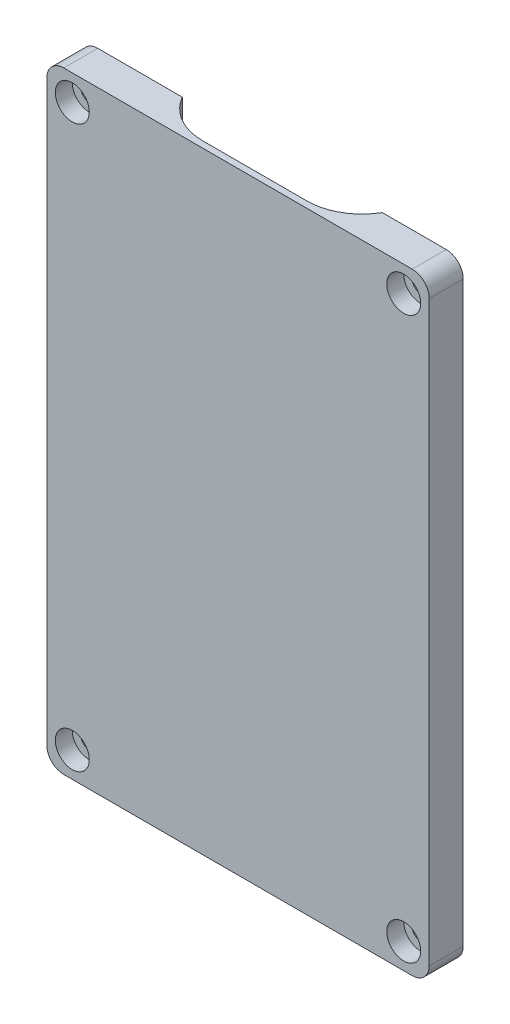
from build123d import *

# Parameters (mm, degrees)
SKETCH_1_W          = 22.5
SKETCH_1_H          = 36
EXTRUDE_1_DEPTH     = 2
SKETCH_9_R          = 1
CUT_EXTRUDE_3_DEPTH = 1
CUT_EXTRUDE_4_REACH = 145.222
SKETCH_10_R         = 0.5
FILLET_1_R          = 1
SKETCH_11_W         = 5.762947655
SKETCH_11_H         = 2.6557086
EXTRUDE_2_DEPTH     = 2.7
SKETCH_12_W         = 8
SKETCH_12_H         = 1.496173859
EXTRUDE_3_DEPTH     = 2.2
SKETCH_14_W         = 2
SKETCH_14_H         = 13.482091112
CUT_EXTRUDE_6_DEPTH = 0.0001
FILLET_3_R          = 2
CUT_EXTRUDE_7_DEPTH = 2.62
FILLET_7_R          = 1


with BuildPart() as part:
    # 草图1 → 凸台-拉伸1 (new body)
    with BuildSketch(Plane.XY):
        with Locations((-109.040086771, 59.72858385)):
            Rectangle(SKETCH_1_W, SKETCH_1_H)
    extrude(amount=EXTRUDE_1_DEPTH)

    # 草图9 → 切除-拉伸3 (cut)
    with BuildSketch(Plane.XY.offset(2)):
        with Locations((-99.290086771, 76.22858385)):
            Circle(SKETCH_9_R)
        with Locations((-99.290086771, 43.22858385)):
            Circle(SKETCH_9_R)
        with Locations((-118.790086771, 43.22858385)):
            Circle(SKETCH_9_R)
        with Locations((-118.790086771, 76.22858385)):
            Circle(SKETCH_9_R)
    extrude(amount=-CUT_EXTRUDE_3_DEPTH, mode=Mode.SUBTRACT)

    # 草图10 → 切除-拉伸4 (cut, up to next)
    with BuildSketch(Plane.XY.offset(1), mode=Mode.PRIVATE) as cut_extrude_4_sk1:
        with Locations((-118.790086771, 43.22858385)):
            Circle(SKETCH_10_R)
    cut_extrude_4_tool1 = extrude(cut_extrude_4_sk1.sketch, amount=-CUT_EXTRUDE_4_REACH, mode=Mode.PRIVATE) & part.part
    # 草图10 → 切除-拉伸4 (cut, up to next)
    with BuildSketch(Plane.XY.offset(1), mode=Mode.PRIVATE) as cut_extrude_4_sk2:
        with Locations((-99.290086771, 43.22858385)):
            Circle(SKETCH_10_R)
    cut_extrude_4_tool2 = extrude(cut_extrude_4_sk2.sketch, amount=-CUT_EXTRUDE_4_REACH, mode=Mode.PRIVATE) & part.part
    # 草图10 → 切除-拉伸4 (cut, up to next)
    with BuildSketch(Plane.XY.offset(1), mode=Mode.PRIVATE) as cut_extrude_4_sk3:
        with Locations((-99.290086771, 76.22858385)):
            Circle(SKETCH_10_R)
    cut_extrude_4_tool3 = extrude(cut_extrude_4_sk3.sketch, amount=-CUT_EXTRUDE_4_REACH, mode=Mode.PRIVATE) & part.part
    # 草图10 → 切除-拉伸4 (cut, up to next)
    with BuildSketch(Plane.XY.offset(1), mode=Mode.PRIVATE) as cut_extrude_4_sk4:
        with Locations((-118.790086771, 76.22858385)):
            Circle(SKETCH_10_R)
    cut_extrude_4_tool4 = extrude(cut_extrude_4_sk4.sketch, amount=-CUT_EXTRUDE_4_REACH, mode=Mode.PRIVATE) & part.part
    add(cut_extrude_4_tool1.solids().sort_by_distance((-118.790087, 43.228584, 1))[0], mode=Mode.SUBTRACT)
    add(cut_extrude_4_tool2.solids().sort_by_distance((-99.290087, 43.228584, 1))[0], mode=Mode.SUBTRACT)
    add(cut_extrude_4_tool3.solids().sort_by_distance((-99.290087, 76.228584, 1))[0], mode=Mode.SUBTRACT)
    add(cut_extrude_4_tool4.solids().sort_by_distance((-118.790087, 76.228584, 1))[0], mode=Mode.SUBTRACT)

    # 圆角1
    fillet_1_edges = [part.edges().sort_by_distance(p)[0] for p in [
        (-97.790086771, 41.72858385, 1),
        (-120.290086771, 41.72858385, 1),
        (-120.290086771, 77.72858385, 1),
        (-97.790086771, 77.72858385, 1),
    ]]
    fillet(fillet_1_edges, radius=FILLET_1_R)

    # 草图11 → 凸台-拉伸2 (add)
    with BuildSketch(Plane(origin=(0, 0, 0), x_dir=(-1, 0, 0), z_dir=(0, 0, -1))):
        with Locations((108.208612944, 66.20072955)):
            Rectangle(SKETCH_11_W, SKETCH_11_H)
    extrude(amount=EXTRUDE_2_DEPTH)

    # 草图12 → 凸台-拉伸3 (add)
    with BuildSketch(Plane(origin=(0, 0, 0), x_dir=(-1, 0, 0), z_dir=(0, 0, -1))):
        with Locations((109.081368677, 52.476670779)):
            Rectangle(SKETCH_12_W, SKETCH_12_H)
    extrude(amount=EXTRUDE_3_DEPTH)

    # 草图14 → 切除-拉伸6 (cut)
    with BuildSketch(Plane.ZY.offset(120.290086771)):
        with Locations((1, 68.480990424)):
            Rectangle(SKETCH_14_W, SKETCH_14_H)
    extrude(amount=-CUT_EXTRUDE_6_DEPTH, mode=Mode.SUBTRACT)

    # 圆角3
    # the kernel refuses this fillet: 2 mm, written as the material it takes off along each edge
    with BuildSketch(Plane(origin=(-120.289986771, 61.739944868, 0), x_dir=(1, 0, 0), z_dir=(0, 1, 0))) as fillet_3_piece_1:
        with BuildLine():
            CenterArc((FILLET_3_R, -FILLET_3_R), FILLET_3_R, 90, 90)
            Line((0, -FILLET_3_R), (0, 0))
            Line((0, 0), (FILLET_3_R, 0))
        make_face()
    extrude(amount=13.482091112, mode=Mode.SUBTRACT)

    # 草图16 → 切除-拉伸7 (cut)
    with BuildSketch(Plane(origin=(0, 77.72858385, 0), x_dir=(1, 0, 0), z_dir=(0, 1, 0))):
        with BuildLine():
            Line((-111.502300349, 4.875), (-105.366426438, 4.875))
            ThreePointArc((-105.366426438, 4.875), (-102.116426438, 1.625), (-105.366426438, -1.625))
            Line((-105.366426438, -1.625), (-111.502300349, -1.625))
            ThreePointArc((-111.502300349, -1.625), (-114.752300349, 1.625), (-111.502300349, 4.875))
        make_face()
    extrude(amount=-CUT_EXTRUDE_7_DEPTH, mode=Mode.SUBTRACT)

    # 圆角7
    # the kernel refuses this fillet: 1 mm, written as the material it takes off along each edge
    with BuildSketch(Plane(origin=(-120.290086771, 61.739944868, 4.5), x_dir=(0, -1, 0), z_dir=(0, 0, -1))) as fillet_7_piece_1_section:
        with BuildLine():
            CenterArc((FILLET_7_R, -FILLET_7_R), FILLET_7_R, 90, 90)
            Line((0, -FILLET_7_R), (0, 0))
            Line((0, 0), (FILLET_7_R, 0))
        make_face()
    fillet_7_piece_1 = extrude(amount=7, mode=Mode.PRIVATE)
    fillet_7_piece_1 = fillet_7_piece_1 - Plane(origin=(-118.289986771, 61.479548888, 2), x_dir=(1, 0, 0), z_dir=(0, -1, 0)) * Cylinder(2, 18, mode=Mode.PRIVATE)
    add(fillet_7_piece_1, mode=Mode.SUBTRACT)
    with BuildSketch(Plane(origin=(-120.290086771, 75.22203598, -2.5), x_dir=(1, 0, 0), z_dir=(0, 0, 1))) as fillet_7_piece_2_section:
        with BuildLine():
            CenterArc((FILLET_7_R, FILLET_7_R), FILLET_7_R, 180, 90)
            Line((0, FILLET_7_R), (0, 0))
            Line((0, 0), (FILLET_7_R, 0))
        make_face()
    fillet_7_piece_2 = extrude(amount=7, mode=Mode.PRIVATE)
    fillet_7_piece_2 = fillet_7_piece_2 - Plane(origin=(-118.289986771, 75.482431596, 2), x_dir=(1, 0, 0), z_dir=(0, -1, 0)) * Cylinder(2, 18, mode=Mode.PRIVATE)
    add(fillet_7_piece_2, mode=Mode.SUBTRACT)


solid = part.part
